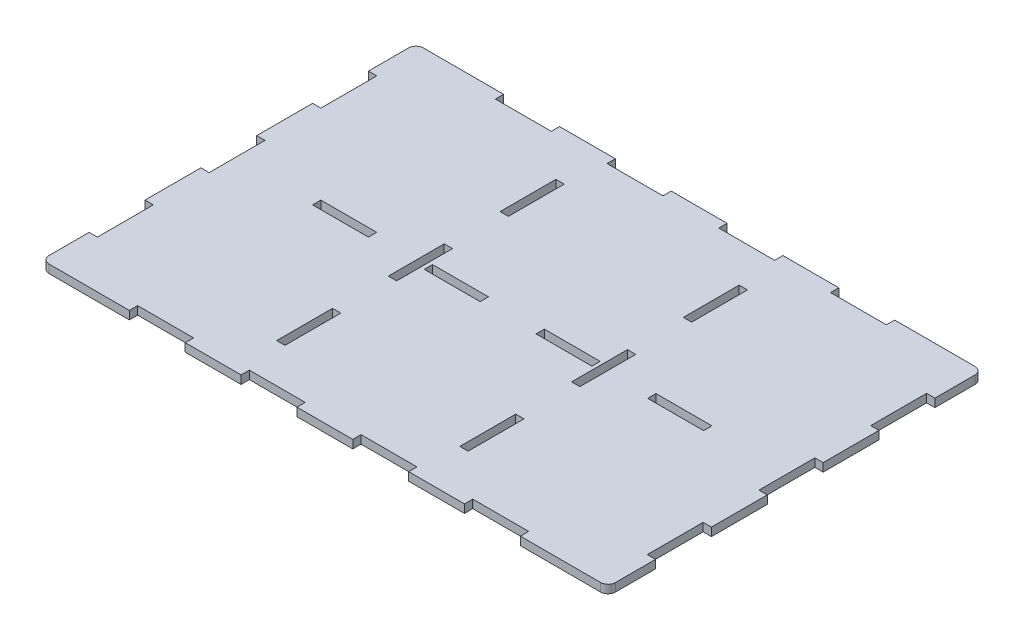
from build123d import *

# Parameters (mm, degrees)
SKETCH1_W                   = 500
SKETCH1_H                   = 300
BOSS_EXTRUDE1_DEPTH         = 6
CUT_EXTRUDE_THIN5_START     = -6
CUT_EXTRUDE_THIN5_OUTLINE_W = 500
CUT_EXTRUDE_THIN5_OUTLINE_H = 300
CUT_EXTRUDE_THIN5_DEPTH     = 6


# Read off the part's stored shape, not the designer's step: Cut-Extrude-Thin5
with BuildPart() as part:
    # Sketch1 → Boss-Extrude1 (new body)
    with BuildSketch(Plane(origin=(0, 0, 0), x_dir=(1, 0, 0), z_dir=(0, 1, 0))):
        Rectangle(SKETCH1_W, SKETCH1_H)
    extrude(amount=BOSS_EXTRUDE1_DEPTH)

    # Cut-Extrude-Thin5 outline → Cut-Extrude-Thin5 (cut)
    # profile 1 of 11: a face of its own
    with BuildSketch(Plane(origin=(0, 6, 0), x_dir=(1, 0, 0), z_dir=(0, 1, 0)).offset(CUT_EXTRUDE_THIN5_START)):
        Rectangle(CUT_EXTRUDE_THIN5_OUTLINE_W, CUT_EXTRUDE_THIN5_OUTLINE_H)
        with BuildLine():
            add(Edge.make_bspline(
                [(-218.57293763, -136.174433659), (-218.57293763, -139.155626025), (-216.156310947, -141.572252709), (-213.17511858, -141.572252709)],
                knots=[0, 0, 0, 0, 1, 1, 1, 1], degree=3))
            Line((-218.57293763, -136.174433659), (-218.57293763, -107.127249928))
            Line((-218.57293763, -107.127249928), (-212.577937465, -107.127249928))
            Line((-212.577937465, -107.127249928), (-212.577937465, -107.122249928))
            Line((-212.577937465, -107.122249928), (-212.572937465, -107.122249928))
            Line((-212.572937465, -107.122249928), (-212.572937465, -66.622248811))
            Line((-212.572937465, -66.622248811), (-212.577937465, -66.622248811))
            Line((-212.577937465, -66.622248811), (-212.577937465, -66.617248811))
            Line((-212.577937465, -66.617248811), (-218.57293763, -66.617248811))
            Line((-218.57293763, -66.617248811), (-218.57293763, -26.127247695))
            Line((-218.57293763, -26.127247695), (-212.577937465, -26.127247695))
            Line((-212.577937465, -26.127247695), (-212.577937465, -26.122247695))
            Line((-212.577937465, -26.122247695), (-212.572937465, -26.122247695))
            Line((-212.572937465, -26.122247695), (-212.572937465, 14.377753421))
            Line((-212.572937465, 14.377753421), (-212.577937465, 14.377753421))
            Line((-212.577937465, 14.377753421), (-212.577937465, 14.382753421))
            Line((-212.577937465, 14.382753421), (-218.57293763, 14.382753421))
            Line((-218.57293763, 14.382753421), (-218.57293763, 54.872754538))
            Line((-218.57293763, 54.872754538), (-212.577937465, 54.872754538))
            Line((-212.577937465, 54.872754538), (-212.577937465, 54.877754538))
            Line((-212.577937465, 54.877754538), (-212.572937465, 54.877754538))
            Line((-212.572937465, 54.877754538), (-212.572937465, 95.377755654))
            Line((-212.572937465, 95.377755654), (-212.577937465, 95.377755654))
            Line((-212.577937465, 95.377755654), (-212.577937465, 95.382755654))
            Line((-212.577937465, 95.382755654), (-218.57293763, 95.382755654))
            Line((-218.57293763, 95.382755654), (-218.57293763, 124.437346792))
            add(Edge.make_bspline(
                [(-213.182525987, 129.827758435), (-216.159627356, 129.827758435), (-218.57293763, 127.414448161), (-218.57293763, 124.437346792)],
                knots=[0, 0, 0, 0, 1, 1, 1, 1], degree=3))
            Line((-213.182525987, 129.827758435), (-154.977936334, 129.827758435))
            Line((-154.977936334, 129.827758435), (-154.977936334, 123.83275827))
            Line((-154.977936334, 123.83275827), (-154.972936334, 123.83275827))
            Line((-154.972936334, 123.83275827), (-154.972936334, 123.82775827))
            Line((-154.972936334, 123.82775827), (-114.472931403, 123.82775827))
            Line((-114.472931403, 123.82775827), (-114.472931403, 123.83275827))
            Line((-114.472931403, 123.83275827), (-114.467931403, 123.83275827))
            Line((-114.467931403, 123.83275827), (-114.467931403, 129.827758435))
            Line((-114.467931403, 129.827758435), (-73.977937916, 129.827758435))
            Line((-73.977937916, 129.827758435), (-73.977937916, 123.83275827))
            Line((-73.977937916, 123.83275827), (-73.972937916, 123.83275827))
            Line((-73.972937916, 123.83275827), (-73.972937916, 123.82775827))
            Line((-73.972937916, 123.82775827), (-33.4729368, 123.82775827))
            Line((-33.4729368, 123.82775827), (-33.4729368, 123.83275827))
            Line((-33.4729368, 123.83275827), (-33.4679368, 123.83275827))
            Line((-33.4679368, 123.83275827), (-33.4679368, 129.827758435))
            Line((-33.4679368, 129.827758435), (7.022064316, 129.827758435))
            Line((7.022064316, 129.827758435), (7.022064316, 123.83275827))
            Line((7.022064316, 123.83275827), (7.027064316, 123.83275827))
            Line((7.027064316, 123.83275827), (7.027064316, 123.82775827))
            Line((7.027064316, 123.82775827), (47.527080692, 123.82775827))
            Line((47.527080692, 123.82775827), (47.527080692, 123.83275827))
            Line((47.527080692, 123.83275827), (47.532080692, 123.83275827))
            Line((47.532080692, 123.83275827), (47.532080692, 129.827758435))
            Line((47.532080692, 129.827758435), (88.022081808, 129.827758435))
            Line((88.022081808, 129.827758435), (88.022081808, 123.83275827))
            Line((88.022081808, 123.83275827), (88.027081808, 123.83275827))
            Line((88.027081808, 123.83275827), (88.027081808, 123.82775827))
            Line((88.027081808, 123.82775827), (128.527082924, 123.82775827))
            Line((128.527082924, 123.82775827), (128.527082924, 123.83275827))
            Line((128.527082924, 123.83275827), (128.532082924, 123.83275827))
            Line((128.532082924, 123.83275827), (128.532082924, 129.827758435))
            Line((128.532082924, 129.827758435), (186.73367345, 129.827758435))
            add(Edge.make_bspline(
                [(192.127065147, 124.434366739), (192.127065147, 127.413113946), (189.712420657, 129.827758435), (186.73367345, 129.827758435)],
                knots=[0, 0, 0, 0, 1, 1, 1, 1], degree=3))
            Line((192.127065147, 124.434366739), (192.127065147, 95.382755654))
            Line((192.127065147, 95.382755654), (186.132064981, 95.382755654))
            Line((186.132064981, 95.382755654), (186.132064981, 95.377755654))
            Line((186.132064981, 95.377755654), (186.127064981, 95.377755654))
            Line((186.127064981, 95.377755654), (186.127064981, 54.877754538))
            Line((186.127064981, 54.877754538), (186.132064981, 54.877754538))
            Line((186.132064981, 54.877754538), (186.132064981, 54.872754538))
            Line((186.132064981, 54.872754538), (192.127065147, 54.872754538))
            Line((192.127065147, 54.872754538), (192.127065147, 14.382753421))
            Line((192.127065147, 14.382753421), (186.132064981, 14.382753421))
            Line((186.132064981, 14.382753421), (186.132064981, 14.377753421))
            Line((186.132064981, 14.377753421), (186.127064981, 14.377753421))
            Line((186.127064981, 14.377753421), (186.127064981, -26.122247695))
            Line((186.127064981, -26.122247695), (186.132064981, -26.122247695))
            Line((186.132064981, -26.122247695), (186.132064981, -26.127247695))
            Line((186.132064981, -26.127247695), (192.127065147, -26.127247695))
            Line((192.127065147, -26.127247695), (192.127065147, -66.617248811))
            Line((192.127065147, -66.617248811), (186.132064981, -66.617248811))
            Line((186.132064981, -66.617248811), (186.132064981, -66.622248811))
            Line((186.132064981, -66.622248811), (186.127064981, -66.622248811))
            Line((186.127064981, -66.622248811), (186.127064981, -107.122249928))
            Line((186.127064981, -107.122249928), (186.132064981, -107.122249928))
            Line((186.132064981, -107.122249928), (186.132064981, -107.127249928))
            Line((186.132064981, -107.127249928), (192.127065147, -107.127249928))
            Line((192.127065147, -107.127249928), (192.127065147, -136.178803142))
            add(Edge.make_bspline(
                [(186.73361558, -141.572252709), (189.712394748, -141.572252709), (192.127065147, -139.15758231), (192.127065147, -136.178803142)],
                knots=[0, 0, 0, 0, 1, 1, 1, 1], degree=3))
            Line((186.73361558, -141.572252709), (128.532082924, -141.572252709))
            Line((128.532082924, -141.572252709), (128.532082924, -135.577252543))
            Line((128.532082924, -135.577252543), (128.527082924, -135.577252543))
            Line((128.527082924, -135.577252543), (128.527082924, -135.572252543))
            Line((128.527082924, -135.572252543), (88.027081808, -135.572252543))
            Line((88.027081808, -135.572252543), (88.027081808, -135.577252543))
            Line((88.027081808, -135.577252543), (88.022081808, -135.577252543))
            Line((88.022081808, -135.577252543), (88.022081808, -141.572252709))
            Line((88.022081808, -141.572252709), (47.532080692, -141.572252709))
            Line((47.532080692, -141.572252709), (47.532080692, -135.577252543))
            Line((47.532080692, -135.577252543), (47.527080692, -135.577252543))
            Line((47.527080692, -135.577252543), (47.527080692, -135.572252543))
            Line((47.527080692, -135.572252543), (7.027064316, -135.572252543))
            Line((7.027064316, -135.572252543), (7.027064316, -135.577252543))
            Line((7.027064316, -135.577252543), (7.022064316, -135.577252543))
            Line((7.022064316, -135.577252543), (7.022064316, -141.572252709))
            Line((7.022064316, -141.572252709), (-33.4679368, -141.572252709))
            Line((-33.4679368, -141.572252709), (-33.4679368, -135.577252543))
            Line((-33.4679368, -135.577252543), (-33.4729368, -135.577252543))
            Line((-33.4729368, -135.577252543), (-33.4729368, -135.572252543))
            Line((-33.4729368, -135.572252543), (-73.972937916, -135.572252543))
            Line((-73.972937916, -135.572252543), (-73.972937916, -135.577252543))
            Line((-73.972937916, -135.577252543), (-73.977937916, -135.577252543))
            Line((-73.977937916, -135.577252543), (-73.977937916, -141.572252709))
            Line((-73.977937916, -141.572252709), (-114.467931403, -141.572252709))
            Line((-114.467931403, -141.572252709), (-114.467931403, -135.577252543))
            Line((-114.467931403, -135.577252543), (-114.472931403, -135.577252543))
            Line((-114.472931403, -135.577252543), (-114.472931403, -135.572252543))
            Line((-114.472931403, -135.572252543), (-154.972936334, -135.572252543))
            Line((-154.972936334, -135.572252543), (-154.972936334, -135.577252543))
            Line((-154.972936334, -135.577252543), (-154.977936334, -135.577252543))
            Line((-154.977936334, -135.577252543), (-154.977936334, -141.572252709))
            Line((-154.977936334, -141.572252709), (-213.17511858, -141.572252709))
        make_face(mode=Mode.SUBTRACT)
    # profile 2 of 11: a face of its own
    with BuildSketch(Plane(origin=(0, 6, 0), x_dir=(1, 0, 0), z_dir=(0, 1, 0)).offset(CUT_EXTRUDE_THIN5_START)):
        Polygon((7.193546784, -8.87724722), (47.6935479, -8.87724722), (47.6935479, -8.87224722), (47.6985479, -8.87224722), (47.6985479, -2.872247054), (47.6935479, -2.872247054), (47.6935479, -2.867247054), (7.193546784, -2.867247054), (7.193546784, -2.872247054), (7.188546784, -2.872247054), (7.188546784, -8.87224722), (7.193546784, -8.87224722), align=None)
    # profile 3 of 11: a face of its own
    with BuildSketch(Plane(origin=(0, 6, 0), x_dir=(1, 0, 0), z_dir=(0, 1, 0)).offset(CUT_EXTRUDE_THIN5_START)):
        Polygon((88.193549017, -8.87724722), (128.693550133, -8.87724722), (128.693550133, -8.87224722), (128.698550133, -8.87224722), (128.698550133, -2.872247054), (128.693550133, -2.872247054), (128.693550133, -2.867247054), (88.193549017, -2.867247054), (88.193549017, -2.872247054), (88.188549017, -2.872247054), (88.188549017, -8.87224722), (88.193549017, -8.87224722), align=None)
    # profile 4 of 11: a face of its own
    with BuildSketch(Plane(origin=(0, 6, 0), x_dir=(1, 0, 0), z_dir=(0, 1, 0)).offset(CUT_EXTRUDE_THIN5_START)):
        Polygon((-154.806457682, -8.87724722), (-114.306456565, -8.87724722), (-114.306456565, -8.87224722), (-114.301456565, -8.87224722), (-114.301456565, -2.872247054), (-114.306456565, -2.872247054), (-114.306456565, -2.867247054), (-154.806457682, -2.867247054), (-154.806457682, -2.872247054), (-154.811457682, -2.872247054), (-154.811457682, -8.87224722), (-154.806457682, -8.87224722), align=None)
    # profile 5 of 11: a face of its own
    with BuildSketch(Plane(origin=(0, 6, 0), x_dir=(1, 0, 0), z_dir=(0, 1, 0)).offset(CUT_EXTRUDE_THIN5_START)):
        Polygon((-73.806455449, -8.87724722), (-33.306454332, -8.87724722), (-33.306454332, -8.87224722), (-33.301454332, -8.87224722), (-33.301454332, -2.872247054), (-33.306454332, -2.872247054), (-33.306454332, -2.867247054), (-73.806455449, -2.867247054), (-73.806455449, -2.872247054), (-73.811455449, -2.872247054), (-73.811455449, -8.87224722), (-73.806455449, -8.87224722), align=None)
    # profile 6 of 11: a face of its own
    with BuildSketch(Plane(origin=(0, 6, 0), x_dir=(1, 0, 0), z_dir=(0, 1, 0)).offset(CUT_EXTRUDE_THIN5_START)):
        Polygon((-82.618567812, -66.622016539), (-82.618567812, -107.122017655), (-82.613567812, -107.122017655), (-82.613567812, -107.127017655), (-76.613537129, -107.127017655), (-76.613537129, -107.122017655), (-76.608537129, -107.122017655), (-76.608537129, -66.622016539), (-76.613537129, -66.622016539), (-76.613537129, -66.617016539), (-82.613567812, -66.617016539), (-82.613567812, -66.622016539), align=None)
    # profile 7 of 11: a face of its own
    with BuildSketch(Plane(origin=(0, 6, 0), x_dir=(1, 0, 0), z_dir=(0, 1, 0)).offset(CUT_EXTRUDE_THIN5_START)):
        Polygon((-82.618567812, 95.377987927), (-82.618567812, 54.87798681), (-82.613567812, 54.87798681), (-82.613567812, 54.87298681), (-76.613537129, 54.87298681), (-76.613537129, 54.87798681), (-76.608537129, 54.87798681), (-76.608537129, 95.377987927), (-76.613537129, 95.377987927), (-76.613537129, 95.382987927), (-82.613567812, 95.382987927), (-82.613567812, 95.377987927), align=None)
    # profile 8 of 11: a face of its own
    with BuildSketch(Plane(origin=(0, 6, 0), x_dir=(1, 0, 0), z_dir=(0, 1, 0)).offset(CUT_EXTRUDE_THIN5_START)):
        Polygon((-82.613567812, -26.127015422), (-76.613537129, -26.127015422), (-76.613537129, -26.122015422), (-76.608537129, -26.122015422), (-76.608537129, 14.377985694), (-76.613537129, 14.377985694), (-76.613537129, 14.382985694), (-82.613567812, 14.382985694), (-82.613567812, 14.377985694), (-82.618567812, 14.377985694), (-82.618567812, -26.122015422), (-82.613567812, -26.122015422), align=None)
    # profile 9 of 11: a face of its own
    with BuildSketch(Plane(origin=(0, 6, 0), x_dir=(1, 0, 0), z_dir=(0, 1, 0)).offset(CUT_EXTRUDE_THIN5_START)):
        Polygon((50.235497613, -66.622248811), (50.230497613, -66.622248811), (50.230497613, -107.122249928), (50.235497613, -107.122249928), (50.235497613, -107.127249928), (56.235528296, -107.127249928), (56.235528296, -107.122249928), (56.240528296, -107.122249928), (56.240528296, -66.622248811), (56.235528296, -66.622248811), (56.235528296, -66.617248811), (50.235497613, -66.617248811), align=None)
    # profile 10 of 11: a face of its own
    with BuildSketch(Plane(origin=(0, 6, 0), x_dir=(1, 0, 0), z_dir=(0, 1, 0)).offset(CUT_EXTRUDE_THIN5_START)):
        Polygon((50.235497613, 14.377753421), (50.230497613, 14.377753421), (50.230497613, -26.122247695), (50.235497613, -26.122247695), (50.235497613, -26.127247695), (56.235528296, -26.127247695), (56.235528296, -26.122247695), (56.240528296, -26.122247695), (56.240528296, 14.377753421), (56.235528296, 14.377753421), (56.235528296, 14.382753421), (50.235497613, 14.382753421), align=None)
    # profile 11 of 11: a face of its own
    with BuildSketch(Plane(origin=(0, 6, 0), x_dir=(1, 0, 0), z_dir=(0, 1, 0)).offset(CUT_EXTRUDE_THIN5_START)):
        Polygon((50.235497613, 95.377755654), (50.230497613, 95.377755654), (50.230497613, 54.877754538), (50.235497613, 54.877754538), (50.235497613, 54.872754538), (56.235528296, 54.872754538), (56.235528296, 54.877754538), (56.240528296, 54.877754538), (56.240528296, 95.377755654), (56.235528296, 95.377755654), (56.235528296, 95.382755654), (50.235497613, 95.382755654), align=None)
    extrude(amount=CUT_EXTRUDE_THIN5_DEPTH, mode=Mode.SUBTRACT)


solid = part.part
